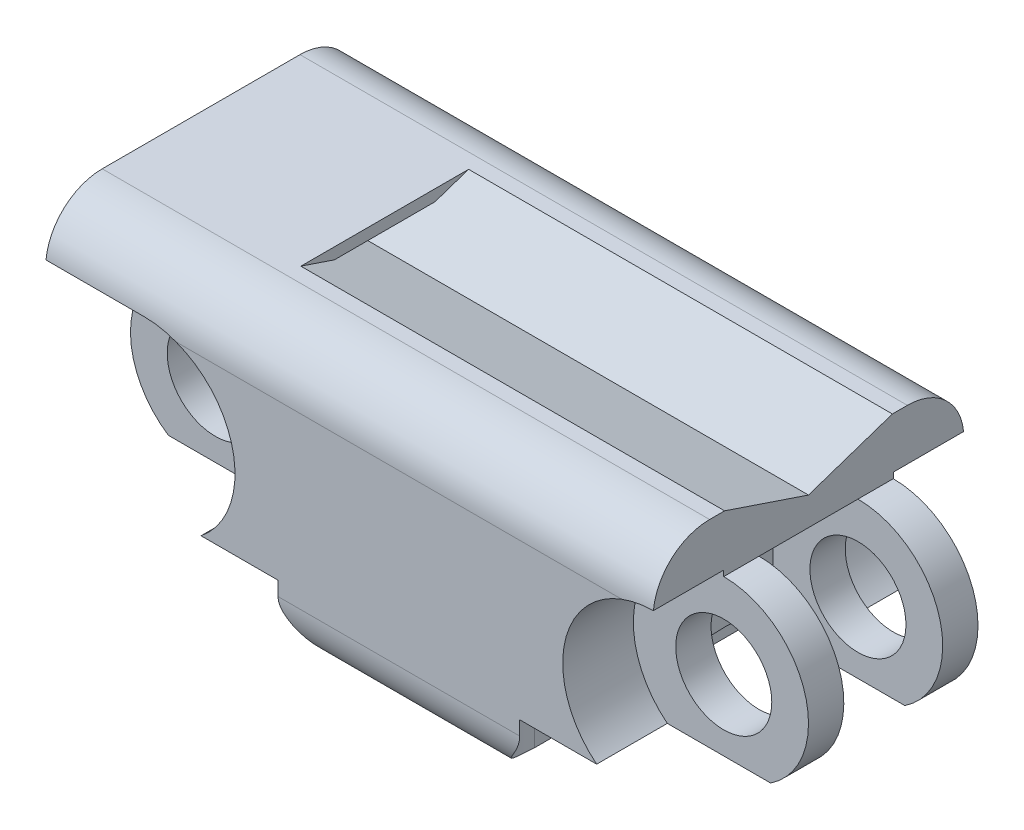
from build123d import *
from build123d.topology import SkipClean

# Parameters (mm, degrees)
SKETCH1_R               = 1.7
BOSS_EXTRUDE1_DEPTH     = 3
BOSS_EXTRUDE2_DEPTH     = 18
CUT_EXTRUDE3_DEPTH      = 1.75
CUT_EXTRUDE4_DEPTH      = 23.27666941
CUT_EXTRUDE4_DEPTH_BACK = 23.27666941
SKETCH8_R               = 1.7
SKETCH12_R              = 3.2
CUT_EXTRUDE6_DEPTH      = 5
SKETCH9_RX              = 3
SKETCH9_RY              = 1.5
CUT_EXTRUDE5_DEPTH      = 23.489543402
CUT_EXTRUDE5_DEPTH_BACK = 23.489543402
CUT_EXTRUDE7_START      = -2.5
CUT_EXTRUDE7_DEPTH      = 3
SKETCH14_W              = 3
SKETCH14_H              = 7
BOSS_EXTRUDE3_DEPTH     = 0.4
BOSS_EXTRUDE4_START     = 3.5
BOSS_EXTRUDE4_DEPTH     = 3.5


with BuildPart() as part:
    # Sketch1 → Boss-Extrude1 (new, symmetric)
    with BuildSketch(Plane.XY):
        with BuildLine():
            Line((0, -3), (18, -3))
            ThreePointArc((18, -3), (21, 0), (18, 3))
            Line((18, 3), (0, 3))
            ThreePointArc((0, 3), (-3, 0), (0, -3))
        make_face()
        Circle(SKETCH1_R, mode=Mode.SUBTRACT)
        with Locations((18, 0)):
            Circle(SKETCH1_R, mode=Mode.SUBTRACT)
    extrude(amount=BOSS_EXTRUDE1_DEPTH, both=True)

    # Sketch7 → Boss-Extrude2 (add)
    with BuildSketch(Plane(origin=(0, 0, 0), x_dir=(0, 0, -1), z_dir=(1, 0, 0))):
        with BuildLine():
            Line((-3.5, -5), (3.5, -5))
            ThreePointArc((3.5, -5), (4.914213562, -4.414213562), (5.5, -3))
            Line((5.5, -3), (5.5, 3))
            ThreePointArc((5.5, 3), (4.914213562, 4.414213562), (3.5, 5))
            Line((3.5, 5), (-3.5, 5))
            ThreePointArc((-3.5, 5), (-4.914213562, 4.414213562), (-5.5, 3))
            Line((-5.5, 3), (-5.5, -3))
            ThreePointArc((-5.5, -3), (-4.914213562, -4.414213562), (-3.5, -5))
        make_face()
    extrude(amount=BOSS_EXTRUDE2_DEPTH)

    # Sketch4 → Cut-Extrude3 (cut, symmetric)
    with BuildSketch(Plane.XY):
        with BuildLine():
            Line((3, 0), (3, -3))
            Line((3, -3), (3, -5.590909202))
            Line((3, -5.590909202), (0, -5.590909202))
            Line((0, -5.590909202), (0, -3))
            ThreePointArc((0, -3), (-2.121320344, 2.121320344), (3, 0))
        make_face()
        with BuildLine():
            Line((15, 0), (15, -3))
            Line((15, -3), (15, -5.613534345))
            Line((15, -5.613534345), (18, -5.613534345))
            Line((18, -5.613534345), (18, -3))
            ThreePointArc((18, -3), (20.121320344, 2.121320344), (15, 0))
        make_face()
    extrude(amount=CUT_EXTRUDE3_DEPTH, both=True, mode=Mode.SUBTRACT)

    # Sketch8 → Cut-Extrude4 (cut, two sides: drawn at the far end of the back side and taken through both)
    with SkipClean():  # the faces are left unmerged after this step: merging them gives an invalid solid
        with BuildSketch(Plane.XY.offset(-CUT_EXTRUDE4_DEPTH_BACK)):
            Circle(SKETCH8_R)
            with Locations((18, 0)):
                Circle(SKETCH8_R)
        extrude(amount=CUT_EXTRUDE4_DEPTH + CUT_EXTRUDE4_DEPTH_BACK, mode=Mode.SUBTRACT)

    # Sketch12 → Cut-Extrude6 (cut)
    with SkipClean():  # the faces are left unmerged after this step: merging them gives an invalid solid
        with BuildSketch(Plane(origin=(0, 0, -3), x_dir=(-1, 0, 0), z_dir=(0, 0, -1))):
            with Locations((-18, 0)):
                Circle(SKETCH12_R)
            Circle(SKETCH12_R)
        cut_extrude6 = extrude(amount=CUT_EXTRUDE6_DEPTH, mode=Mode.SUBTRACT)

    # Mirror1: Cut-Extrude6 across plane
    with SkipClean():  # the faces are left unmerged after this step: merging them gives an invalid solid
        add(cut_extrude6.mirror(Plane.XY), mode=Mode.SUBTRACT)

    # Cut-Sweep1: sweep along a path in Sketch10
    with SkipClean():  # the faces are left unmerged after this step: merging them gives an invalid solid
        with BuildLine() as cut_sweep1_path:  # in the path sketch's own coordinates; laid on its plane below (add() does not lay a ready-made edge on the line's plane)
            add(Edge.make_bspline(
                [(15, -1.936876745), (10.269582022, -2.10908778), (5.184865419, -1.094788945), (0.881575243, -3.548843571)],
                knots=[0, 0, 0, 0, 1, 1, 1, 1], degree=3))
        # Sketch9 → Cut-Sweep1 (sweep, cut)
        with BuildSketch(Plane(origin=(15, 0, 0), x_dir=(0, 0, -1), z_dir=(1, 0, 0))):
            with Locations(Location((0, -3.06331148), (0, 0, 180))):
                Ellipse(SKETCH9_RX, SKETCH9_RY)
        sweep(path=Plane.XY * cut_sweep1_path.line, mode=Mode.SUBTRACT)

    # Sketch11 → Cut-Extrude5 (cut, two sides: drawn at the far end of the back side and taken through both)
    with SkipClean():  # the faces are left unmerged after this step: merging them gives an invalid solid
        with BuildSketch(Plane(origin=(0, 0, 0), x_dir=(0, 0, -1), z_dir=(1, 0, 0)).offset(-CUT_EXTRUDE5_DEPTH_BACK)):
            Polygon((0, 4), (3.5, 5.178637832), (3.5, 7.951817237), (-3.5, 7.951817237), (-3.5, 5.178637832), align=None)
        extrude(amount=CUT_EXTRUDE5_DEPTH + CUT_EXTRUDE5_DEPTH_BACK, mode=Mode.SUBTRACT)

    # Sketch13 → Cut-Extrude7 (cut)
    with SkipClean():  # the faces are left unmerged after this step: merging them gives an invalid solid
        with BuildSketch(Plane(origin=(0, 0, 0), x_dir=(1, 0, 0), z_dir=(0, 1, 0)).offset(CUT_EXTRUDE7_START)):
            with BuildLine():
                Line((4.1, -5.6), (-4.1, -5.6))
                Line((-4.1, -5.6), (-4.1, 5.6))
                Line((-4.1, 5.6), (4.1, 5.6))
                ThreePointArc((4.1, 5.6), (5.514213562, 5.014213562), (6.1, 3.6))
                Line((6.1, 3.6), (6.1, -3.6))
                ThreePointArc((6.1, -3.6), (5.514213562, -5.014213562), (4.1, -5.6))
            make_face()
            with BuildLine():
                Line((13.9, -5.6), (22.1, -5.6))
                Line((22.1, -5.6), (22.1, 5.6))
                Line((22.1, 5.6), (13.9, 5.6))
                ThreePointArc((13.9, 5.6), (12.485786438, 5.014213562), (11.9, 3.6))
                Line((11.9, 3.6), (11.9, -3.6))
                ThreePointArc((11.9, -3.6), (12.485786438, -5.014213562), (13.9, -5.6))
            make_face()
        extrude(amount=-CUT_EXTRUDE7_DEPTH, mode=Mode.SUBTRACT)

    # Sketch14 → Boss-Extrude3 (add)
    with SkipClean():  # the faces are left unmerged after this step: merging them gives an invalid solid
        with BuildSketch(Plane(origin=(0, 5, 0), x_dir=(1, 0, 0), z_dir=(0, 1, 0))):
            with Locations((1.5, 0)):
                Rectangle(SKETCH14_W, SKETCH14_H)
        extrude(amount=-BOSS_EXTRUDE3_DEPTH)

    # Sketch15 → Boss-Extrude4 (add)
    with SkipClean():  # the faces are left unmerged after this step: merging them gives an invalid solid
        with BuildSketch(Plane.ZY.offset(BOSS_EXTRUDE4_START)):
            with BuildLine():
                Line((3.5, 5), (-3.5, 5))
                ThreePointArc((-3.5, 5), (-4.841640786, 4.483239697), (-5.489974874, 3.2))
                Line((-5.489974874, 3.2), (-3, 3.2))
                Line((-3, 3.2), (-3, 3))
                Line((-3, 3), (-1.75, 3))
                Line((-1.75, 3), (1.75, 3))
                Line((1.75, 3), (3, 3))
                Line((3, 3), (3, 3.2))
                Line((3, 3.2), (5.489974874, 3.2))
                ThreePointArc((5.489974874, 3.2), (4.841640786, 4.483239697), (3.5, 5))
            make_face()
            Polygon((-1.781717796, 4.6), (1.781717796, 4.6), (0, 4), align=None, mode=Mode.SUBTRACT)
        extrude(amount=-BOSS_EXTRUDE4_DEPTH)


solid = part.part
